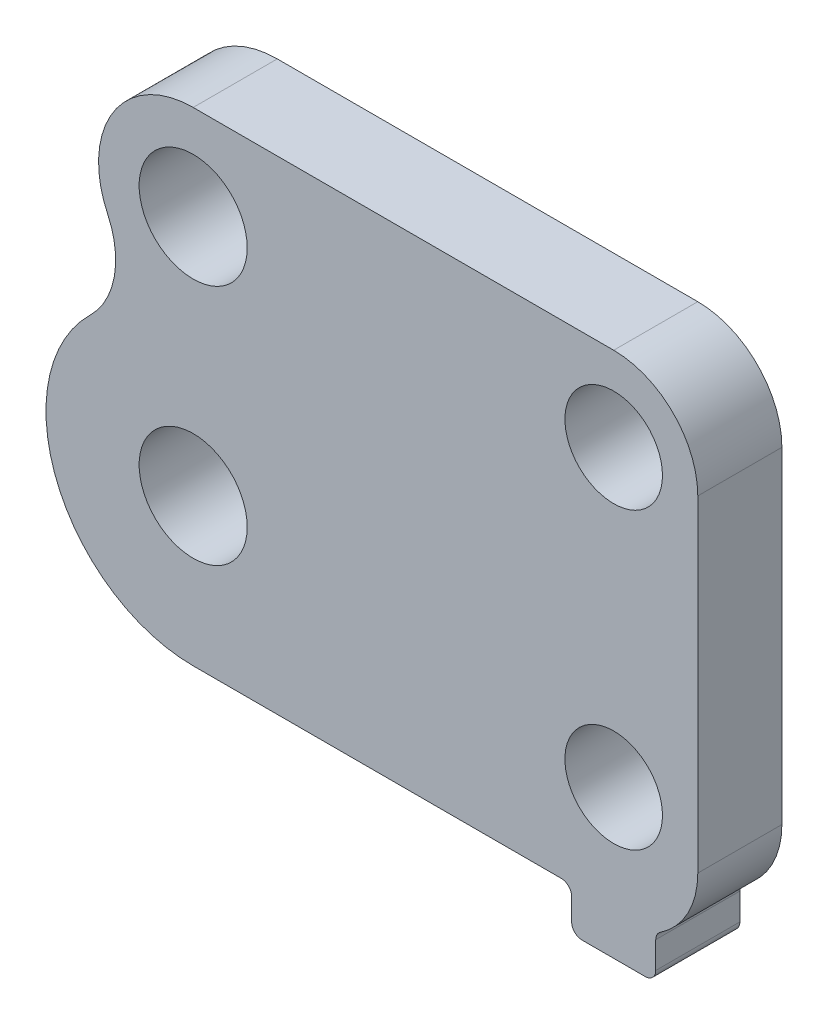
from build123d import *

# Parameters (mm, degrees)
SKETCH3_R           = 1.8415
SKETCH3_R_2         = 2.0399375
BOSS_EXTRUDE1_DEPTH = 3.175
FILLET1_R           = 3.175
FILLET2_R           = 0.396875


with BuildPart() as part:
    # Sketch3 → Boss-Extrude1 (new body)
    with BuildSketch(Plane.XY):
        with BuildLine():
            Line((0, -5.55625), (14.2875, -5.55625))
            Line((14.2875, -5.55625), (14.2875, -7.18185))
            Line((14.2875, -7.18185), (17.4625, -7.18185))
            Line((17.4625, -7.18185), (17.4625, -5.55625))
            Line((17.4625, -5.55625), (19.05, -5.55625))
            Line((19.05, -5.55625), (19.05, 12.7))
            Line((19.05, 12.7), (0, 12.7))
            ThreePointArc((0, 12.7), (-3.017240851, 11.039812386), (-3.229688204, 7.602541465))
            ThreePointArc((-3.229688204, 7.602541465), (-2.975666517, 5.684416089), (-3.882150485, 3.975024739))
            ThreePointArc((-3.882150485, 3.975024739), (-5.145782024, -2.095910644), (0, -5.55625))
        make_face()
        with Locations((15.875, 9.525)):
            Circle(SKETCH3_R, mode=Mode.SUBTRACT)
        with Locations((15.875, -1.5875)):
            Circle(SKETCH3_R, mode=Mode.SUBTRACT)
        with Locations((0, 9.128125)):
            Circle(SKETCH3_R_2, mode=Mode.SUBTRACT)
        Circle(SKETCH3_R_2, mode=Mode.SUBTRACT)
    extrude(amount=BOSS_EXTRUDE1_DEPTH)

    # Fillet1
    # the kernel refuses this fillet: 3.175 mm, written as the material it takes off along each edge
    with BuildSketch(Plane(origin=(19.05, -5.55625, -6.874076643), x_dir=(-1, 0, 0), z_dir=(0, 0, 1))) as fillet1_piece_1:
        with BuildLine():
            CenterArc((3.175, -2.749630657), FILLET1_R, 120, 60)
            Line((0, -2.749630657), (-0.0635, -2.749630657))
            Line((-0.0635, -2.749630657), (-0.0635, 0))
            Line((-0.0635, 0), (0, 0.0635))
            ThreePointArc((0, 0.0635), (0.79375, 0.0635), (1.55575, 0.054992613))
            Line((1.55575, 0.054992613), (1.5875, 0))
        make_face()
    extrude(amount=16.923153285, mode=Mode.SUBTRACT)
    with BuildSketch(Plane(origin=(19.05, 12.7, -7.9375), x_dir=(0, -1, 0), z_dir=(0, 0, 1))) as fillet1_piece_2:
        with BuildLine():
            CenterArc((FILLET1_R, -FILLET1_R), FILLET1_R, 90, 90)
            Line((0, -FILLET1_R), (-FILLET1_R * 0.02, -FILLET1_R))
            Line((-FILLET1_R * 0.02, -FILLET1_R), (-FILLET1_R * 0.02, FILLET1_R * 0.02))
            Line((-FILLET1_R * 0.02, FILLET1_R * 0.02), (FILLET1_R, FILLET1_R * 0.02))
            Line((FILLET1_R, FILLET1_R * 0.02), (FILLET1_R, 0))
        make_face()
    extrude(amount=19.05, mode=Mode.SUBTRACT)

    # Fillet2
    fillet2_edges = [part.edges().sort_by_distance(p)[0] for p in [
        (17.4625, -5.55625, 1.5875),
        (17.4625, -7.18185, 1.5875),
        (14.2875, -7.18185, 1.5875),
        (14.2875, -5.55625, 1.5875),
    ]]
    fillet(fillet2_edges, radius=FILLET2_R)


solid = part.part
